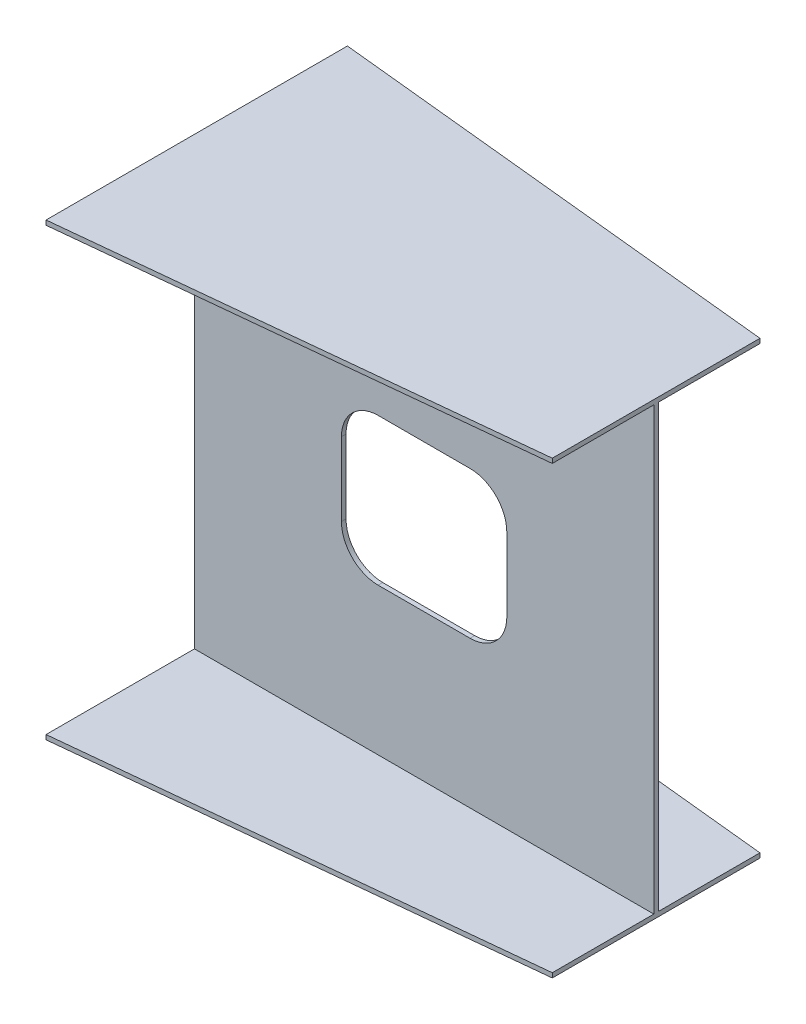
from build123d import *

# Parameters (mm, degrees)
CUT_EXTRUDE1_DEPTH = 1163.320523937


with BuildPart() as part:
    # Sketch1 → Loft l1 section 0
    with BuildSketch(Plane(origin=(0, 0, 0), x_dir=(0, 0, -1), z_dir=(1, 0, 0))):
        with BuildLine():
            Line((-333, 490), (323, 490))
            Line((323, 490), (323, 480))
            Line((323, 480), (0, 480))
            Line((0, 480), (0, -480))
            Line((0, -480), (323, -480))
            Line((323, -480), (323, -490))
            Line((323, -490), (-333, -490))
            Line((-333, -490), (-333, -480))
            Line((-333, -480), (-10, -480))
            Line((-10, -480), (-10, 480))
            Line((-10, 480), (-333, 480))
            Line((-333, 480), (-333, 490))
        make_face()
    # Sketch4 → Loft l1 section 1
    with BuildSketch(Plane(origin=(1000, 0, -1000), x_dir=(0, 0, 1), z_dir=(-1, 0, 0))):
        with BuildLine():
            Line((779, 490), (1231, 490))
            Line((1231, 490), (1231, 480))
            Line((1231, 480), (1010, 480))
            Line((1010, 480), (1010, -480))
            Line((1010, -480), (1231, -480))
            Line((1231, -480), (1231, -490))
            Line((1231, -490), (779, -490))
            Line((779, -490), (779, -480))
            Line((779, -480), (1000, -480))
            Line((1000, -480), (1000, 480))
            Line((1000, 480), (779, 480))
            Line((779, 480), (779, 490))
        make_face()
    loft()

    # Sketch6 → Cut-Extrude1 (cut, through all)
    with BuildSketch(Plane.XY.offset(10)):
        with BuildLine():
            Line((400, -160), (600, -160))
            ThreePointArc((600, -160), (656.568542495, -136.568542495), (680, -80))
            Line((680, -80), (680, 80))
            ThreePointArc((680, 80), (656.568542495, 136.568542495), (600, 160))
            Line((600, 160), (400, 160))
            ThreePointArc((400, 160), (343.431457505, 136.568542495), (320, 80))
            Line((320, 80), (320, -80))
            ThreePointArc((320, -80), (343.431457505, -136.568542495), (400, -160))
        make_face()
    extrude(amount=-CUT_EXTRUDE1_DEPTH, mode=Mode.SUBTRACT)


solid = part.part
